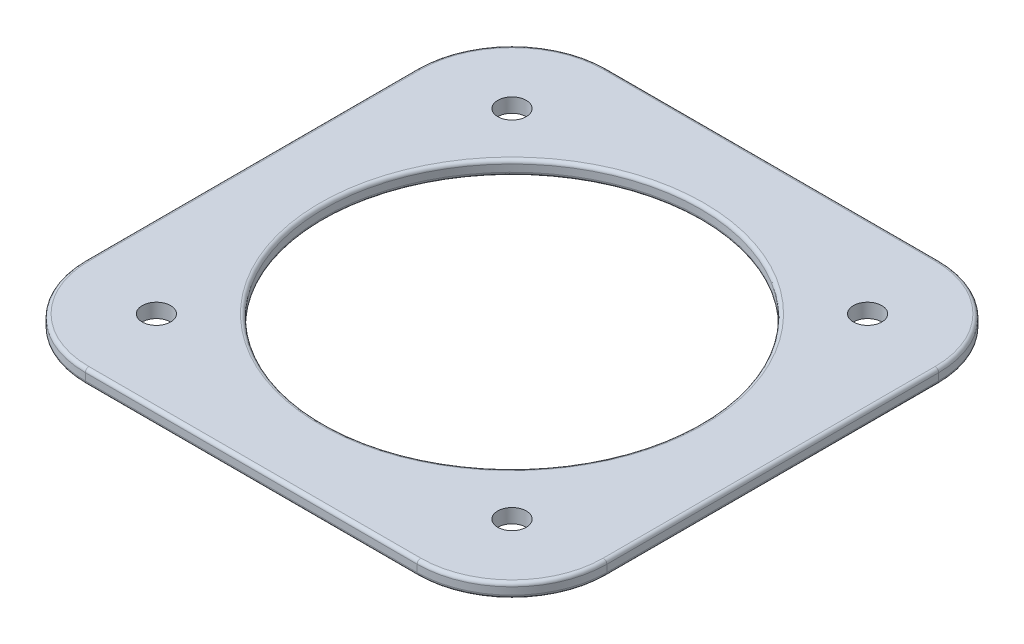
from build123d import *

# Parameters (mm, degrees)
SKETCH1_R                       = 79.5
BOSS_EXTRUDE1_DEPTH             = 6
FILLET1_R                       = 1.5
CBORE_FOR_M10_SHCS1_D           = 12
CBORE_FOR_M10_SHCS1_CBORE_D     = 18
CBORE_FOR_M10_SHCS1_CBORE_DEPTH = 10


with BuildPart() as part:
    # Sketch1 → Boss-Extrude1 (new body)
    with BuildSketch(Plane(origin=(0, 0, 0), x_dir=(1, 0, 0), z_dir=(0, 1, 0))):
        with BuildLine():
            Line((-70, -110), (70, -110))
            ThreePointArc((70, -110), (98.284271247, -98.284271247), (110, -70))
            Line((110, -70), (110, 70))
            ThreePointArc((110, 70), (98.284271247, 98.284271247), (70, 110))
            Line((70, 110), (-70, 110))
            ThreePointArc((-70, 110), (-98.284271247, 98.284271247), (-110, 70))
            Line((-110, 70), (-110, -70))
            ThreePointArc((-110, -70), (-98.284271247, -98.284271247), (-70, -110))
        make_face()
        Circle(SKETCH1_R, mode=Mode.SUBTRACT)
    extrude(amount=BOSS_EXTRUDE1_DEPTH)

    # Fillet1
    fillet1_edges = [part.edges().sort_by_distance(p)[0] for p in [
        (-79.5, 0, 0),
        (0, 0, 110),
        (98.284271247, 0, 98.284271247),
        (110, 0, 0),
        (98.284271247, 0, -98.284271247),
        (0, 0, -110),
        (-98.284271247, 0, -98.284271247),
        (-110, 0, 0),
        (-98.284271247, 0, 98.284271247),
        (-79.5, 6, 0),
        (-110, 6, 0),
        (-98.284271247, 6, -98.284271247),
        (0, 6, -110),
        (98.284271247, 6, -98.284271247),
        (110, 6, 0),
        (98.284271247, 6, 98.284271247),
        (0, 6, 110),
        (-98.284271247, 6, 98.284271247),
    ]]
    fillet(fillet1_edges, radius=FILLET1_R)

    # CBORE for M10 SHCS1 (through all)
    with Locations(Plane(origin=(0, 21, 0), x_dir=(-0.7071067811865489, 0, 0.7071067811865462), z_dir=(0, 1, 0))):
        with Locations((0, 0), (-106.066017178, 0), (0, 106.066017178), (106.066017178, 0), (0, -106.066017178), (176.776695297, 176.776695297), (-176.776695297, 176.776695297), (176.776695297, -176.776695297), (-176.776695297, -176.776695297)):
            CounterBoreHole(CBORE_FOR_M10_SHCS1_D / 2, CBORE_FOR_M10_SHCS1_CBORE_D / 2, CBORE_FOR_M10_SHCS1_CBORE_DEPTH)


solid = part.part
